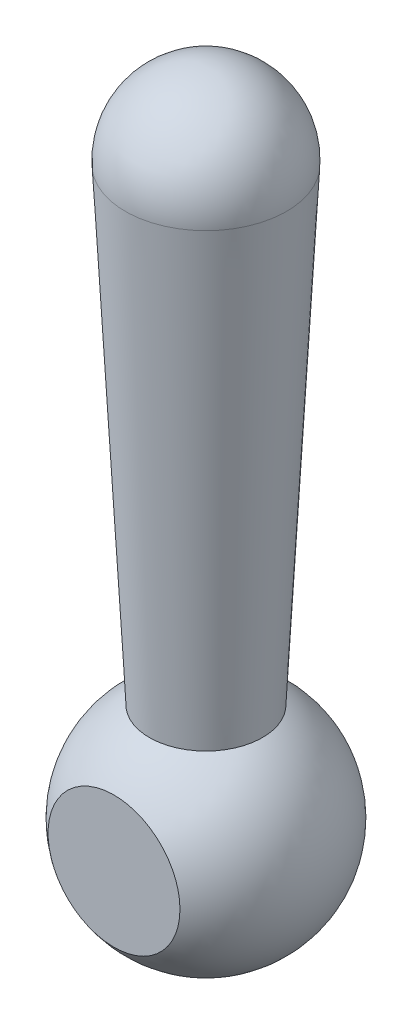
from build123d import *
from build123d.topology import SkipClean

# Parameters (mm, degrees)
CUT_EXTRUDE2_START     = -2.331632996
CUT_EXTRUDE2_OUTLINE_W = 1.749848069
CUT_EXTRUDE2_OUTLINE_H = 8
CUT_EXTRUDE2_DEPTH     = 4.663265992


# Read off the part's stored shape, not the designer's step: Cut-Extrude2
with BuildPart() as part:
    # Sketch1 → Revolve1 (revolve)
    with BuildSketch(Plane.XY):
        with BuildLine():
            Line((-2.85, 19.999735291), (-2, 3.464101615))
            ThreePointArc((-2, 3.464101615), (-3.863703305, -1.03527618), (0, -4))
            Line((0, -4), (0, 23))
            ThreePointArc((0, 23), (-2.069063093, 22.1116736), (-2.85, 19.999735291))
        make_face()
    revolve(axis=Axis((0, 0, 0), (0, 1, 0)))

    # Cut-Extrude2 outline → Cut-Extrude2 (cut)
    with SkipClean():  # the faces are left unmerged after this step: merging them gives an invalid solid
        with BuildSketch(Plane(origin=(0, 0, 0), x_dir=(0, 0, -1), z_dir=(1, 0, 0)).offset(CUT_EXTRUDE2_START)):
            with Locations((4.125075965, 0)):
                Rectangle(CUT_EXTRUDE2_OUTLINE_W, CUT_EXTRUDE2_OUTLINE_H)
            with Locations((-4.125075965, 0)):
                Rectangle(CUT_EXTRUDE2_OUTLINE_W, CUT_EXTRUDE2_OUTLINE_H)
        extrude(amount=CUT_EXTRUDE2_DEPTH, mode=Mode.SUBTRACT)


solid = part.part
